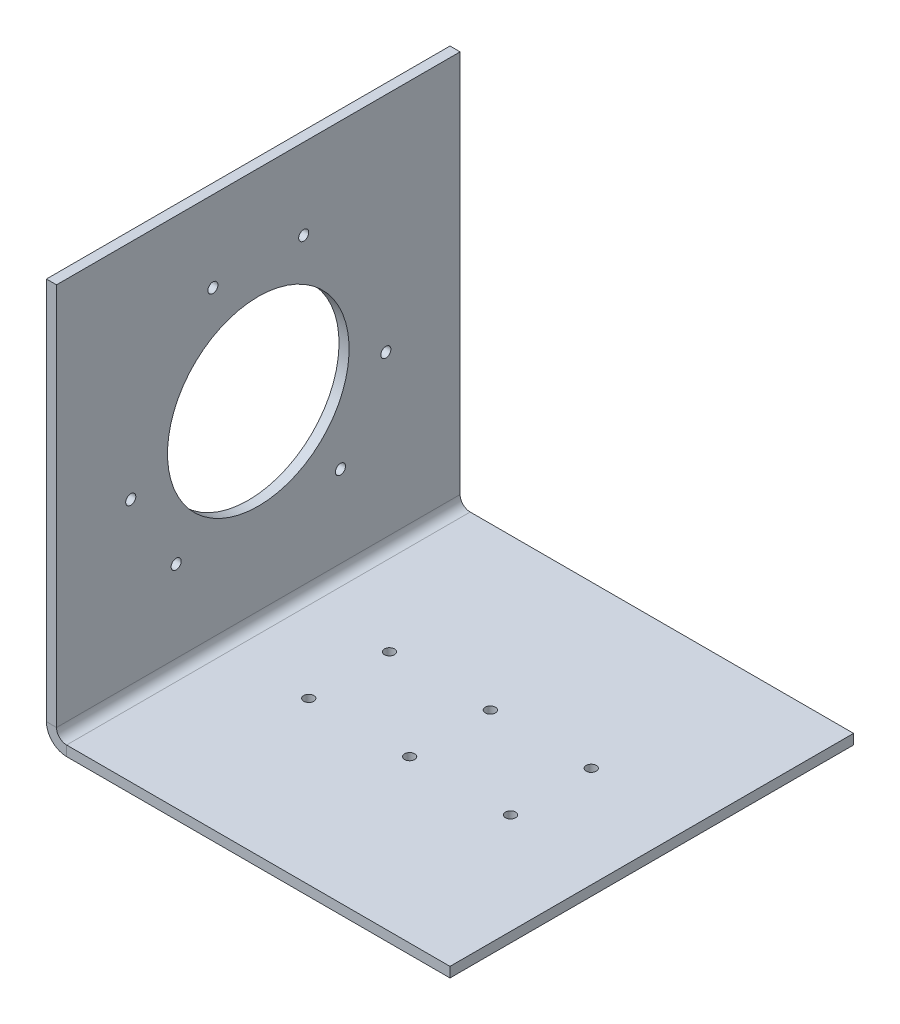
from build123d import *

# Parameters (mm, degrees)
SKETCH2_W                    = 254
SKETCH2_H                    = 254
SKETCH2_R                    = 3.175
BASE_FLANGE1_DEPTH           = 6.35
EDGE_FLANGE1_STRIP_W         = 38.1
EDGE_FLANGE1_STRIP_H         = 6.35
EDGE_FLANGE1_STRIP_CUT_DEPTH = 254
EDGE_FLANGE1_DEPTH           = 254
SKETCH10_R                   = 57.15
CUT_EXTRUDE1_DEPTH           = 437.305538012
SKETCH12_R                   = 3.175
CUT_EXTRUDE2_DEPTH           = 433.639624861


# Sheet-metal steps are written as plain solids
with BuildPart() as part:
    # Sketch2 → Base-Flange1 (new body)
    with BuildSketch(Plane(origin=(0, 0, 0), x_dir=(1, 0, 0), z_dir=(0, 1, 0))):
        with Locations((127, 127)):
            Rectangle(SKETCH2_W, SKETCH2_H)
        with Locations(Location((190.5, 152.4, 0), (0, 0, 270))):
            Circle(SKETCH2_R, mode=Mode.SUBTRACT)
        with Locations(Location((127, 152.4, 0), (0, 0, 270))):
            Circle(SKETCH2_R, mode=Mode.SUBTRACT)
        with Locations(Location((63.5, 152.4, 0), (0, 0, 270))):
            Circle(SKETCH2_R, mode=Mode.SUBTRACT)
        with Locations(Location((127, 101.6, 0), (0, 0, 270))):
            Circle(SKETCH2_R, mode=Mode.SUBTRACT)
        with Locations(Location((63.5, 101.6, 0), (0, 0, 270))):
            Circle(SKETCH2_R, mode=Mode.SUBTRACT)
        with Locations(Location((190.5, 101.6, 0), (0, 0, 270))):
            Circle(SKETCH2_R, mode=Mode.SUBTRACT)
    extrude(amount=-BASE_FLANGE1_DEPTH)

    # Edge-Flange1 strip (across the edge) → Edge-Flange1 strip cut (cut)
    with BuildSketch(Plane.XY.offset(-254)):
        with Locations((-6.35, -3.175)):
            Rectangle(EDGE_FLANGE1_STRIP_W, EDGE_FLANGE1_STRIP_H)
    extrude(amount=EDGE_FLANGE1_STRIP_CUT_DEPTH, mode=Mode.SUBTRACT)

    # Edge-Flange1 section (across the edge) → Edge-Flange1 (add)
    with BuildSketch(Plane.XY.offset(-254)):
        with BuildLine():
            Line((0, 6.35), (0, 247.65))
            Line((0, 247.65), (6.35, 247.65))
            Line((6.35, 247.65), (6.35, 6.35))
            ThreePointArc((6.35, 6.35), (8.209871939, 1.859871939), (12.7, 0))
            Line((12.7, 0), (12.7, -6.35))
            ThreePointArc((12.7, -6.35), (3.719743879, -2.630256121), (0, 6.35))
        make_face()
    extrude(amount=EDGE_FLANGE1_DEPTH)

    # Sketch10 → Cut-Extrude1 (cut, through all)
    with BuildSketch(Plane.ZY):
        with Locations(Location((-127, 120.65, 0), (0, 0, 270))):
            Circle(SKETCH10_R)
    extrude(amount=-CUT_EXTRUDE1_DEPTH, mode=Mode.SUBTRACT)

    # Sketch12 → Cut-Extrude2 (cut, through all)
    with BuildSketch(Plane(origin=(6.35, 0, 0), x_dir=(0, 0, -1), z_dir=(1, 0, 0))):
        with Locations(Location((75.296364232, 57.803324087, 0), (0, 0, 90))):
            Circle(SKETCH12_R)
        with Locations(Location((46.721364232, 107.296675913, 0), (0, 0, 90))):
            Circle(SKETCH12_R)
        with Locations(Location((98.425, 196.85, 0), (0, 0, 90))):
            Circle(SKETCH12_R)
        with Locations(Location((155.575, 196.85, 0), (0, 0, 90))):
            Circle(SKETCH12_R)
        with Locations(Location((178.703635768, 57.803324087, 0), (0, 0, 90))):
            Circle(SKETCH12_R)
        with Locations(Location((207.278635768, 107.296675913, 0), (0, 0, 90))):
            Circle(SKETCH12_R)
    extrude(amount=-CUT_EXTRUDE2_DEPTH, mode=Mode.SUBTRACT)


solid = part.part
